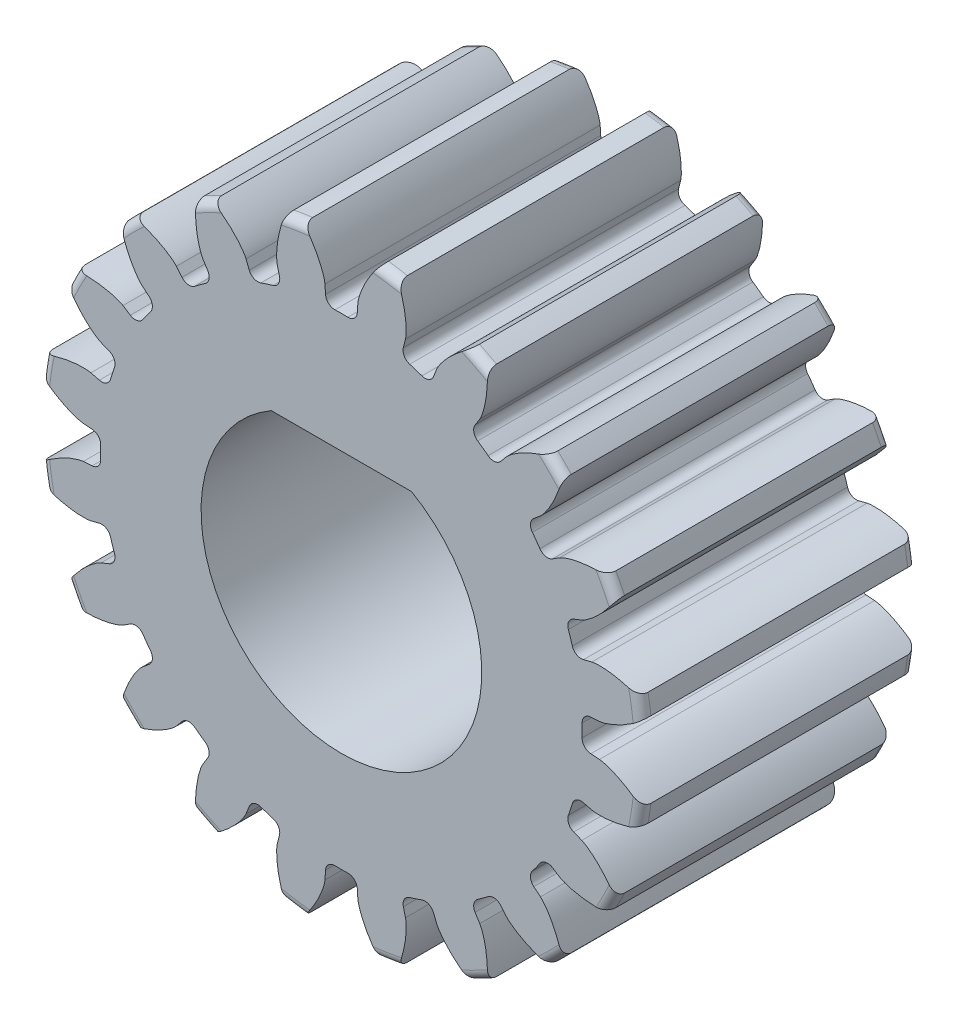
from build123d import *

# Parameters (mm, degrees)
BOSS_EXTRUDE1_DEPTH      = 11.938
BOSS_EXTRUDE1_DEPTH_BACK = 11.938
SKETCH3_R                = 13.97
SKETCH5_W                = 11.176
SKETCH5_H                = 3.302
SKETCH5_W_2              = 23.876
SKETCH5_H_2              = 6.35
FILLET2_R                = 0.426091396
CUT_EXTRUDE1_DEPTH       = 24.083276344
FILLET1_R                = 0.426091396
CIRPATTERN1_COUNT        = 20
FILLET1_OF_CIRPATTERN1_R = 0.426091396
SKETCH7_R                = 19.002420173
CUT_EXTRUDE3_DEPTH       = 11.176
SKETCH8_R                = 6.858
BOSS_EXTRUDE2_DEPTH      = 12.7
CUT_EXTRUDE4_DEPTH       = 24.355875375
CUT_EXTRUDE4_DEPTH_BACK  = 24.355875375


with BuildPart() as part:
    # Sketch3 → Boss-Extrude1 (new, two sides: drawn at the far end of the back side and taken through both)
    with BuildSketch(Plane.XY.offset(-BOSS_EXTRUDE1_DEPTH_BACK)):
        Circle(SKETCH3_R)
    extrude(amount=BOSS_EXTRUDE1_DEPTH + BOSS_EXTRUDE1_DEPTH_BACK)

    # Sketch5 → Cut-Revolve1 (revolve, cut)
    with BuildSketch(Plane(origin=(0, 0, 0), x_dir=(0, 0, -1), z_dir=(1, 0, 0)), mode=Mode.PRIVATE) as cut_revolve1_sk:
        with Locations((-6.35, 12.319)):
            Rectangle(SKETCH5_W, SKETCH5_H)
        with Locations((0, 3.175)):
            Rectangle(SKETCH5_W_2, SKETCH5_H_2)
    revolve(cut_revolve1_sk.sketch.rotate(Axis((0, 0, 11.938), (0, 0, -1)), 90), axis=Axis((0, 0, 11.938), (0, 0, -1)), mode=Mode.SUBTRACT)

    # Fillet2
    fillet2_edges = [part.edges().sort_by_distance(p)[0] for p in [
        (-6.35, 0, 11.938),
        (-6.35, 0, -11.938),
        (-10.668, 0, 11.938),
        (-10.668, 0, 0.762),
        (-13.97, 0, 0.762),
        (-13.97, 0, -11.938),
    ]]
    fillet(fillet2_edges, radius=FILLET2_R)

    # Sketch4 → Cut-Extrude1 (cut, symmetric)
    with BuildSketch(Plane.XY):
        with BuildLine():
            Line((11.090007734, 0.706671577), (11.909941065, 0.758918933))
            add(Edge.make_bspline(
                [(11.909941065, 0.758918933), (11.91319885, 0.75916867), (11.922326373, 0.759999028), (11.939541821, 0.762081733), (11.967563, 0.766207532), (12.003153475, 0.772532437), (12.049006316, 0.78193155), (12.102812796, 0.794575497), (12.161703212, 0.81011376), (12.2254893, 0.828787319), (12.288855455, 0.848977261), (12.351797854, 0.870566157), (12.414244834, 0.89337607), (12.489569754, 0.922542307), (12.579436809, 0.959648005), (12.683765988, 1.006111611), (12.80121371, 1.062447697), (12.919908456, 1.123732073), (13.035856633, 1.187207606), (13.151968715, 1.254962387), (13.263573377, 1.323083241), (13.378357846, 1.397516484), (13.483735575, 1.468094979), (13.600466468, 1.551203565), (13.694286594, 1.619454211), (13.790047056, 1.693297947), (13.836481646, 1.72972993), (13.860139004, 1.748555626)],
                knots=[0, 0, 0, 0, 0, 0.005376749, 0.015083688, 0.02853182, 0.04661014, 0.064854849, 0.092110526, 0.119476176, 0.146842496, 0.174208854, 0.201574956, 0.228941013, 0.256307345, 0.307035032, 0.361767352, 0.416499661, 0.471231937, 0.525964282, 0.580696616, 0.635428982, 0.690161387, 0.744893688, 0.799626082, 0.854358407, 0.909090915, 0.909090915, 0.909090915, 0.909090915, 0.909090915], degree=4))
            ThreePointArc((13.860139004, 1.748555626), (13.97, 0), (13.860139004, -1.748555626))
            add(Edge.make_bspline(
                [(11.909941065, -0.758918933), (11.91319885, -0.75916867), (11.922326373, -0.759999028), (11.939541821, -0.762081733), (11.967563, -0.766207532), (12.003153475, -0.772532437), (12.049006316, -0.78193155), (12.102812796, -0.794575497), (12.161703212, -0.81011376), (12.2254893, -0.828787319), (12.288855455, -0.848977261), (12.351797854, -0.870566157), (12.414244834, -0.89337607), (12.489569754, -0.922542307), (12.579436809, -0.959648005), (12.683765988, -1.006111611), (12.80121371, -1.062447697), (12.919908456, -1.123732073), (13.035856633, -1.187207606), (13.151968715, -1.254962387), (13.263573377, -1.323083241), (13.378357846, -1.397516484), (13.483735575, -1.468094979), (13.600466468, -1.551203565), (13.694286594, -1.619454211), (13.790047056, -1.693297947), (13.836481646, -1.72972993), (13.860139004, -1.748555626)],
                knots=[0, 0, 0, 0, 0, 0.005376749, 0.015083688, 0.02853182, 0.04661014, 0.064854849, 0.092110526, 0.119476176, 0.146842496, 0.174208854, 0.201574956, 0.228941013, 0.256307345, 0.307035032, 0.361767352, 0.416499661, 0.471231937, 0.525964282, 0.580696616, 0.635428982, 0.690161387, 0.744893688, 0.799626082, 0.854358407, 0.909090915, 0.909090915, 0.909090915, 0.909090915, 0.909090915], degree=4))
            Line((11.909941065, -0.758918933), (11.090007734, -0.706671577))
            ThreePointArc((11.090007734, -0.706671577), (11.1125, 0), (11.090007734, 0.706671577))
        make_face()
    cut_extrude1 = extrude(amount=CUT_EXTRUDE1_DEPTH, both=True, mode=Mode.SUBTRACT)

    # Fillet1
    fillet1_edges = [part.edges().sort_by_distance(p)[0] for p in [
        (11.090007734, -0.706671577, -5.588),
        (11.090007734, 0.706671577, -5.588),
    ]]
    fillet(fillet1_edges, radius=FILLET1_R)

    # CirPattern1: Cut-Extrude1 ×20 about axis
    cirpattern1_axis = Axis((0, 0, 11.938), (0, 0, -1))
    for i in range(1, CIRPATTERN1_COUNT):
        add(cut_extrude1.rotate(cirpattern1_axis, i * 360 / CIRPATTERN1_COUNT), mode=Mode.SUBTRACT)

    # Fillet1 of CirPattern1
    fillet1_of_cirpattern1_edges = [part.edges().sort_by_distance(p)[0] for p in [
        (10.328850594, -4.099085466, -5.588),
        (10.765597648, -2.754916249, -5.588),
        (8.556633593, -7.090252309, -5.588),
        (9.387375856, -5.946833678, -5.588),
        (5.946833678, -9.387375856, -5.588),
        (7.090252309, -8.556633593, -5.588),
        (2.754916249, -10.765597648, -5.588),
        (4.099085466, -10.328850594, -5.588),
        (-0.706671577, -11.090007734, -5.588),
        (0.706671577, -11.090007734, -5.588),
        (-4.099085466, -10.328850594, -5.588),
        (-2.754916249, -10.765597648, -5.588),
        (-7.090252309, -8.556633593, -5.588),
        (-5.946833678, -9.387375856, -5.588),
        (-9.387375856, -5.946833678, -5.588),
        (-8.556633593, -7.090252309, -5.588),
        (-10.765597648, -2.754916249, -5.588),
        (-10.328850594, -4.099085466, -5.588),
        (-11.090007734, 0.706671577, -5.588),
        (-11.090007734, -0.706671577, -5.588),
        (-10.328850594, 4.099085466, -5.588),
        (-10.765597648, 2.754916249, -5.588),
        (-8.556633593, 7.090252309, -5.588),
        (-9.387375856, 5.946833678, -5.588),
        (-5.946833678, 9.387375856, -5.588),
        (-7.090252309, 8.556633593, -5.588),
        (-2.754916249, 10.765597648, -5.588),
        (-4.099085466, 10.328850594, -5.588),
        (0.706671577, 11.090007734, -5.588),
        (-0.706671577, 11.090007734, -5.588),
        (4.099085466, 10.328850594, -5.588),
        (2.754916249, 10.765597648, -5.588),
        (7.090252309, 8.556633593, -5.588),
        (5.946833678, 9.387375856, -5.588),
        (9.387375856, 5.946833678, -5.588),
        (8.556633593, 7.090252309, -5.588),
        (10.765597648, 2.754916249, -5.588),
        (10.328850594, 4.099085466, -5.588),
    ]]
    fillet(fillet1_of_cirpattern1_edges, radius=FILLET1_OF_CIRPATTERN1_R)

    # Sketch7 → Cut-Extrude3 (cut)
    with BuildSketch(Plane.XY.offset(11.938)):
        Circle(SKETCH7_R)
    extrude(amount=-CUT_EXTRUDE3_DEPTH, mode=Mode.SUBTRACT)

    # Sketch8 → Boss-Extrude2 (add)
    with BuildSketch(Plane.XY.offset(0.762)):
        Circle(SKETCH8_R)
    extrude(amount=-BOSS_EXTRUDE2_DEPTH)

    # Sketch10 → Cut-Extrude4 (cut, two sides: drawn at the far end of the back side and taken through both)
    with BuildSketch(Plane.XY.offset(0.762).offset(-CUT_EXTRUDE4_DEPTH_BACK)):
        with BuildLine():
            Line((-3.2385, 5.60924654), (3.2385, 5.60924654))
            ThreePointArc((3.2385, 5.60924654), (0, -6.477), (-3.2385, 5.60924654))
        make_face()
    extrude(amount=CUT_EXTRUDE4_DEPTH + CUT_EXTRUDE4_DEPTH_BACK, mode=Mode.SUBTRACT)


solid = part.part
